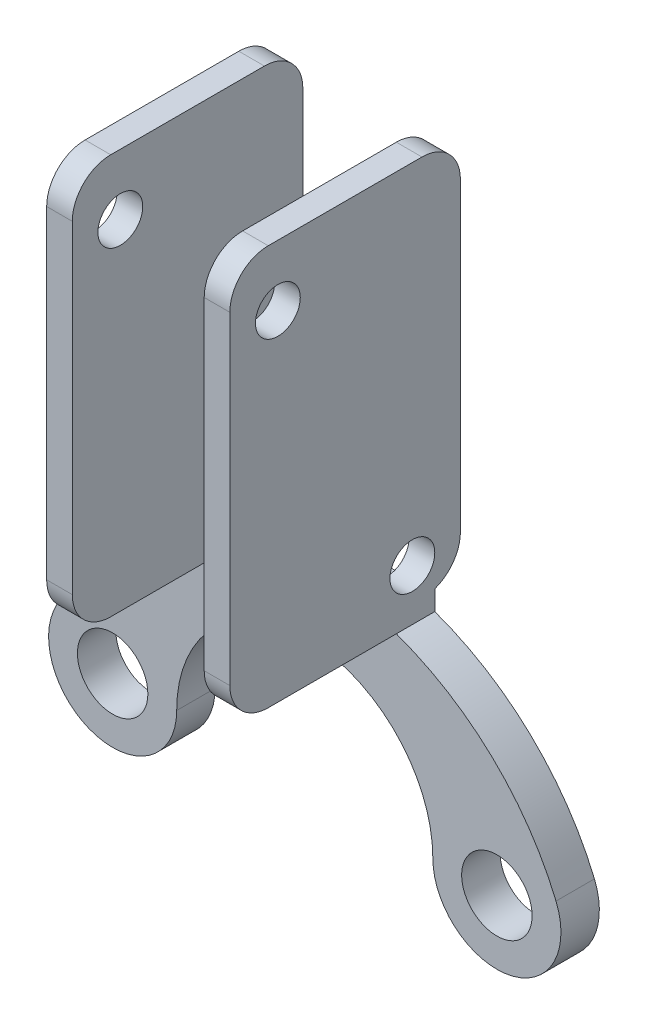
from build123d import *

# Parameters (mm, degrees)
SKETCH2_R           = 5
SKETCH2_R_2         = 2.75
SKETCH2_W           = 2
SKETCH2_H           = 30
BOSS_EXTRUDE1_DEPTH = 3
SKETCH3_W           = 2
SKETCH3_H           = 31.239003023
BOSS_EXTRUDE2_DEPTH = 13
SKETCH4_W           = 2
SKETCH4_H           = 29.7
BOSS_EXTRUDE3_DEPTH = 2
SKETCH5_R           = 1.75
CUT_EXTRUDE1_DEPTH  = 96.357865433
FILLET1_R           = 3


with BuildPart() as part:
    # Sketch2 → Boss-Extrude1 (new body)
    # profile 1 of 13: a face of its own
    with BuildSketch(Plane.XY):
        with BuildLine():
            Line((0, 55), (-5.15, 55))
            Line((-5.15, 55), (-7.15, 55))
            Line((-7.15, 55), (-7.15, 58.760996977))
            ThreePointArc((-7.15, 58.760996977), (-14.633199965, 54.158827301), (-19.615384615, 46.923076923))
            ThreePointArc((-19.615384615, 46.923076923), (-14.019419324, 49.902903378), (-10, 45))
            ThreePointArc((-10, 45), (-7.071067812, 52.071067812), (0, 55))
        make_face()
    # profile 2 of 13: a face of its own
    with BuildSketch(Plane.XY):
        with Locations((-15, 45)):
            Circle(SKETCH2_R)
        with Locations((-15, 45)):
            Circle(SKETCH2_R_2, mode=Mode.SUBTRACT)
    # profile 3 of 13: a face of its own
    with BuildSketch(Plane.XY):
        with BuildLine():
            Line((7.15, 55), (5.15, 55))
            Line((5.15, 55), (0, 55))
            ThreePointArc((0, 55), (7.071067812, 52.071067812), (10, 45))
            ThreePointArc((10, 45), (14.019419324, 49.902903378), (19.615384615, 46.923076923))
            ThreePointArc((19.615384615, 46.923076923), (14.633199965, 54.158827301), (7.15, 58.760996977))
            Line((7.15, 58.760996977), (7.15, 55))
        make_face()
    # profile 4 of 13: a face of its own
    with BuildSketch(Plane.XY):
        with Locations((15, 45)):
            Circle(SKETCH2_R)
        with Locations((15, 45)):
            Circle(SKETCH2_R_2, mode=Mode.SUBTRACT)
    # profile 5 of 13: a face of its own
    with BuildSketch(Plane.XY):
        with BuildLine():
            ThreePointArc((5.15, 59.366498248), (2.594408626, 59.841029939), (0, 60))
            ThreePointArc((0, 60), (-2.594408626, 59.841029939), (-5.15, 59.366498248))
            Line((-5.15, 59.366498248), (-5.15, 55))
            Line((-5.15, 55), (0, 55))
            Line((0, 55), (5.15, 55))
            Line((5.15, 55), (5.15, 59.366498248))
        make_face()
    # profile 6 of 13: a face of its own
    with BuildSketch(Plane.XY):
        with BuildLine():
            ThreePointArc((7.15, 58.760996977), (6.157447356, 59.088346591), (5.15, 59.366498248))
            Line((5.15, 59.366498248), (5.15, 55))
            Line((5.15, 55), (7.15, 55))
            Line((7.15, 55), (7.15, 58.760996977))
        make_face()
    # profile 7 of 13: a face of its own
    with BuildSketch(Plane.XY):
        with BuildLine():
            Line((-5.15, 55), (-5.15, 59.366498248))
            ThreePointArc((-5.15, 59.366498248), (-6.157447356, 59.088346591), (-7.15, 58.760996977))
            Line((-7.15, 58.760996977), (-7.15, 55))
            Line((-7.15, 55), (-5.15, 55))
        make_face()
    # profile 8 of 13: a face of its own
    with BuildSketch(Plane.XY):
        with Locations((-6.15, 75)):
            Rectangle(SKETCH2_W, SKETCH2_H)
    # profile 9 of 13: a face of its own
    with BuildSketch(Plane.XY):
        with BuildLine():
            Line((-5.15, 59.366498248), (-5.15, 60))
            Line((-5.15, 60), (-7.15, 60))
            Line((-7.15, 60), (-7.15, 58.760996977))
            ThreePointArc((-7.15, 58.760996977), (-6.157447356, 59.088346591), (-5.15, 59.366498248))
        make_face()
    # profile 10 of 13: a face of its own
    with BuildSketch(Plane.XY):
        with BuildLine():
            ThreePointArc((-5.15, 59.366498248), (-2.594408626, 59.841029939), (0, 60))
            Line((0, 60), (-5.15, 60))
            Line((-5.15, 60), (-5.15, 59.366498248))
        make_face()
    # profile 11 of 13: a face of its own
    with BuildSketch(Plane.XY):
        with BuildLine():
            Line((5.15, 60), (0, 60))
            ThreePointArc((0, 60), (2.594408626, 59.841029939), (5.15, 59.366498248))
            Line((5.15, 59.366498248), (5.15, 60))
        make_face()
    # profile 12 of 13: a face of its own
    with BuildSketch(Plane.XY):
        with BuildLine():
            Line((7.15, 60), (5.15, 60))
            Line((5.15, 60), (5.15, 59.366498248))
            ThreePointArc((5.15, 59.366498248), (6.157447356, 59.088346591), (7.15, 58.760996977))
            Line((7.15, 58.760996977), (7.15, 60))
        make_face()
    # profile 13 of 13: a face of its own
    with BuildSketch(Plane.XY):
        with Locations((6.15, 75)):
            Rectangle(SKETCH2_W, SKETCH2_H)
    extrude(amount=BOSS_EXTRUDE1_DEPTH)

    # Sketch3 → Boss-Extrude2 (add)
    with BuildSketch(Plane.XY.offset(3)):
        with Locations((-6.15, 74.380498488)):
            Rectangle(SKETCH3_W, SKETCH3_H)
        with Locations((6.15, 74.380498488)):
            Rectangle(SKETCH3_W, SKETCH3_H)
    extrude(amount=BOSS_EXTRUDE2_DEPTH)

    # Sketch4 → Boss-Extrude3 (add)
    with BuildSketch(Plane(origin=(0, 0, 0), x_dir=(-1, 0, 0), z_dir=(0, 0, -1))):
        with Locations((-6.15, 75.15)):
            Rectangle(SKETCH4_W, SKETCH4_H)
        with Locations((6.15, 75.15)):
            Rectangle(SKETCH4_W, SKETCH4_H)
    extrude(amount=BOSS_EXTRUDE3_DEPTH)

    # Sketch5 → Cut-Extrude1 (cut, through all)
    with BuildSketch(Plane(origin=(7.15, 0, 0), x_dir=(0, 0, -1), z_dir=(1, 0, 0))):
        with Locations((-1.75, 62.75)):
            Circle(SKETCH5_R)
        with Locations((-12.25, 85.25)):
            Circle(SKETCH5_R)
    extrude(amount=-CUT_EXTRUDE1_DEPTH, mode=Mode.SUBTRACT)

    # Fillet1
    # the kernel refuses this fillet: 3 mm, written as the material it takes off along each edge
    with BuildSketch(Plane(origin=(1.921067812, 60.3, -2), x_dir=(0, 0, 1), z_dir=(-1, 0, 0))) as fillet1_piece_1:
        with BuildLine():
            CenterArc((3, 2.828427125), FILLET1_R, 180, 70.528779366)
            Line((0, 2.828427125), (-0.06, 2.828427125))
            Line((-0.06, 2.828427125), (-0.06, 0))
            Line((-0.06, 0), (0, -0.06))
            ThreePointArc((0, -0.06), (1, -0.06), (1.98, -0.056568542))
            Line((1.98, -0.056568542), (2, 0))
        make_face()
    extrude(amount=16.142135624, mode=Mode.SUBTRACT)
    with BuildSketch(Plane(origin=(-1.921067812, 60.3, -2), x_dir=(0, 0, 1), z_dir=(1, 0, 0))) as fillet1_piece_2:
        with BuildLine():
            CenterArc((3, -2.828427125), FILLET1_R, 109.471220634, 70.528779366)
            Line((0, -2.828427125), (-0.06, -2.828427125))
            Line((-0.06, -2.828427125), (-0.06, 0))
            Line((-0.06, 0), (0, 0.06))
            ThreePointArc((0, 0.06), (1, 0.06), (1.98, 0.056568542))
            Line((1.98, 0.056568542), (2, 0))
        make_face()
    extrude(amount=16.142135624, mode=Mode.SUBTRACT)
    with BuildSketch(Plane(origin=(14.65, 58.760996977, 16), x_dir=(0, 0, -1), z_dir=(-1, 0, 0)), Plane(origin=(14.65, 90, -2), x_dir=(0, 0, 1), z_dir=(-1, 0, 0)), Plane(origin=(-14.65, 90, -2), x_dir=(0, -1, 0), z_dir=(1, 0, 0)), Plane(origin=(-2.35, 90, 16), x_dir=(0, 0, -1), z_dir=(1, 0, 0)), Plane(origin=(2.35, 90, 16), x_dir=(0, -1, 0), z_dir=(-1, 0, 0))) as fillet1_piece_3:
        with BuildLine():
            CenterArc((FILLET1_R, -FILLET1_R), FILLET1_R, 90, 90)
            Line((0, -FILLET1_R), (-FILLET1_R * 0.02, -FILLET1_R))
            Line((-FILLET1_R * 0.02, -FILLET1_R), (-FILLET1_R * 0.02, FILLET1_R * 0.02))
            Line((-FILLET1_R * 0.02, FILLET1_R * 0.02), (FILLET1_R, FILLET1_R * 0.02))
            Line((FILLET1_R, FILLET1_R * 0.02), (FILLET1_R, 0))
        make_face()
    extrude(amount=17, mode=Mode.SUBTRACT)
    with BuildSketch(Plane(origin=(-14.65, 58.760996977, 16), x_dir=(0, 0, -1), z_dir=(1, 0, 0))) as fillet1_piece_4:
        with BuildLine():
            CenterArc((FILLET1_R, FILLET1_R), FILLET1_R, 180, 90)
            Line((0, FILLET1_R), (-FILLET1_R * 0.02, FILLET1_R))
            Line((-FILLET1_R * 0.02, FILLET1_R), (-FILLET1_R * 0.02, -FILLET1_R * 0.02))
            Line((-FILLET1_R * 0.02, -FILLET1_R * 0.02), (FILLET1_R, -FILLET1_R * 0.02))
            Line((FILLET1_R, -FILLET1_R * 0.02), (FILLET1_R, 0))
        make_face()
    extrude(amount=17, mode=Mode.SUBTRACT)


solid = part.part
